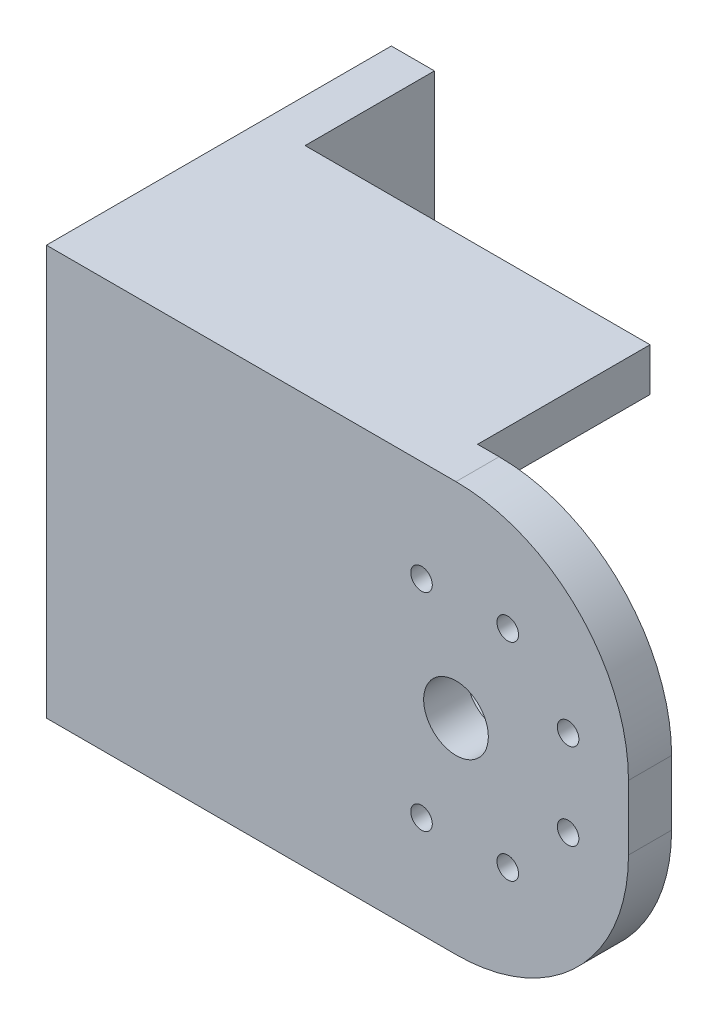
from build123d import *

# Parameters (mm, degrees)
SKETCH3_R           = 7.5
SKETCH3_R_2         = 2.5
BOSS_EXTRUDE1_DEPTH = 10
SKETCH4_W           = 10
SKETCH4_H           = 95
BOSS_EXTRUDE2_DEPTH = 70
SKETCH5_W           = 80
SKETCH5_H           = 10
BOSS_EXTRUDE3_DEPTH = 40
SKETCH6_W           = 32
SKETCH6_H           = 36
CUT_EXTRUDE1_DEPTH  = 43.8
SKETCH8_R           = 7.5
SKETCH8_R_2         = 2.5
CUT_EXTRUDE2_DEPTH  = 43.8


with BuildPart() as part:
    # Sketch3 → Boss-Extrude1 (new body)
    with BuildSketch(Plane.XY):
        with BuildLine():
            Line((68.617133813, 80.05993294), (163.617133813, 80.05993294))
            ThreePointArc((163.617133813, 80.05993294), (191.90140506, 68.344204188), (203.617133813, 40.05993294))
            Line((203.617133813, 40.05993294), (203.617133813, 25.05993294))
            ThreePointArc((203.617133813, 25.05993294), (191.90140506, -3.224338307), (163.617133813, -14.94006706))
            Line((163.617133813, -14.94006706), (68.617133813, -14.94006706))
            Line((68.617133813, -14.94006706), (68.617133813, 80.05993294))
        make_face()
        with Locations((163.617133813, 32.55993294)):
            Circle(SKETCH3_R, mode=Mode.SUBTRACT)
        with Locations((189.617133813, 42.55993294)):
            Circle(SKETCH3_R_2, mode=Mode.SUBTRACT)
        with Locations((155.617133813, 56.55993294)):
            Circle(SKETCH3_R_2, mode=Mode.SUBTRACT)
        with Locations((175.617133813, 56.55993294)):
            Circle(SKETCH3_R_2, mode=Mode.SUBTRACT)
        with Locations((155.617133813, 8.55993294)):
            Circle(SKETCH3_R_2, mode=Mode.SUBTRACT)
        with Locations((175.617133813, 8.55993294)):
            Circle(SKETCH3_R_2, mode=Mode.SUBTRACT)
        with Locations((189.617133813, 22.55993294)):
            Circle(SKETCH3_R_2, mode=Mode.SUBTRACT)
    extrude(amount=BOSS_EXTRUDE1_DEPTH)

    # Sketch4 → Boss-Extrude2 (add)
    with BuildSketch(Plane(origin=(0, 0, 0), x_dir=(-1, 0, 0), z_dir=(0, 0, -1))):
        with Locations((-73.617133813, 32.55993294)):
            Rectangle(SKETCH4_W, SKETCH4_H)
    extrude(amount=BOSS_EXTRUDE2_DEPTH)

    # Sketch5 → Boss-Extrude3 (add)
    with BuildSketch(Plane(origin=(0, 0, 0), x_dir=(-1, 0, 0), z_dir=(0, 0, -1))):
        with Locations((-118.617133813, 75.05993294)):
            Rectangle(SKETCH5_W, SKETCH5_H)
        with Locations((-118.617133813, -9.94006706)):
            Rectangle(SKETCH5_W, SKETCH5_H)
    extrude(amount=BOSS_EXTRUDE3_DEPTH)

    # Sketch6 → Cut-Extrude1 (cut)
    with BuildSketch(Plane.XZ.offset(14.94006706)):
        with Locations((104.617133813, -18)):
            Rectangle(SKETCH6_W, SKETCH6_H)
    extrude(amount=-CUT_EXTRUDE1_DEPTH, mode=Mode.SUBTRACT)

    # Sketch8 → Cut-Extrude2 (cut)
    with BuildSketch(Plane.ZY.offset(-68.617133813)):
        with Locations((-40, 32.55993294)):
            Circle(SKETCH8_R)
        with Locations((-56.167891819, 25.862972874)):
            Circle(SKETCH8_R_2)
        with Locations((-56.167891819, 39.256893006)):
            Circle(SKETCH8_R_2)
        with Locations((-46.696960066, 48.727824759)):
            Circle(SKETCH8_R_2)
        with Locations((-33.303039934, 48.727824759)):
            Circle(SKETCH8_R_2)
        with Locations((-23.832108181, 39.256893006)):
            Circle(SKETCH8_R_2)
        with Locations((-23.832108181, 25.862972874)):
            Circle(SKETCH8_R_2)
        with Locations((-33.303039934, 16.392041121)):
            Circle(SKETCH8_R_2)
        with Locations((-46.696960066, 16.392041121)):
            Circle(SKETCH8_R_2)
    extrude(amount=-CUT_EXTRUDE2_DEPTH, mode=Mode.SUBTRACT)


solid = part.part
